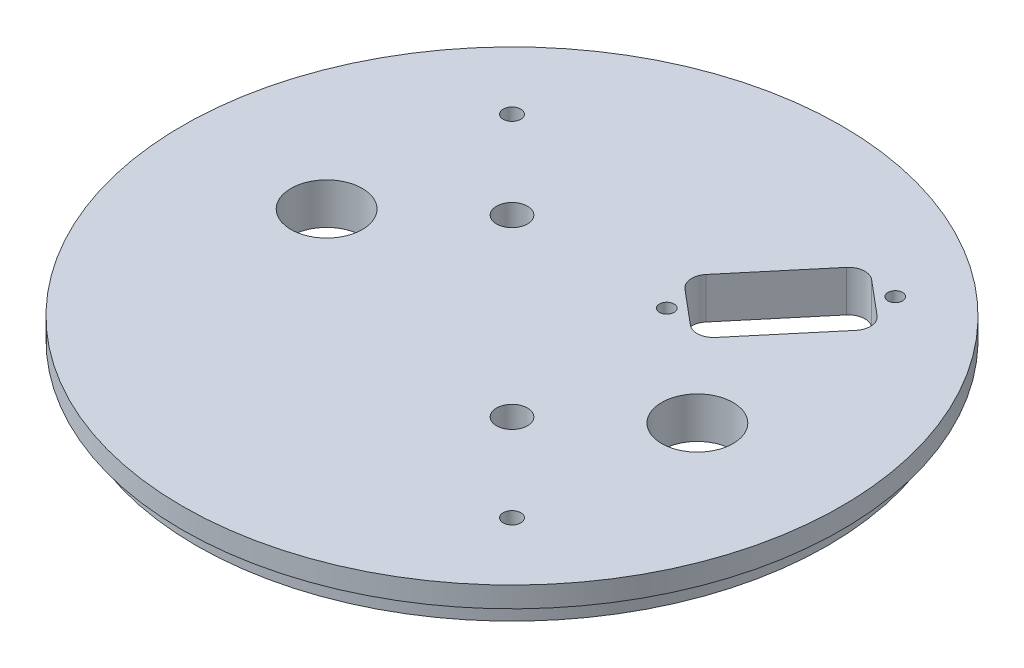
from build123d import *

# Parameters (mm, degrees)
SKETCH1_R                 = 50.8
SKETCH1_R_2               = 5.500000049
SKETCH1_R_3               = 1.3589
SKETCH1_R_4               = 2.38125
BOSS_EXTRUDE1_DEPTH       = 6.35
SKETCH2_R                 = 76.2
SKETCH2_R_2               = 48.641
CUT_EXTRUDE1_DEPTH        = 3.175
CUT_EXTRUDE2_START        = -5.969
CUT_EXTRUDE2_DEPTH        = 3.556
TAP_DRILL_FOR_4_40_TAP1_D = 2.2606
CUT_EXTRUDE3_DEPTH        = 73.122135992


with BuildPart() as part:
    # Sketch1 → Boss-Extrude1 (new body)
    with BuildSketch(Plane(origin=(0, 0, 0), x_dir=(1, 0, 0), z_dir=(0, 1, 0))):
        Circle(SKETCH1_R)
        with Locations((28.575, 0)):
            Circle(SKETCH1_R_2, mode=Mode.SUBTRACT)
        with Locations((-28.575, 0)):
            Circle(SKETCH1_R_2, mode=Mode.SUBTRACT)
        with Locations((-26.940768363, 26.940768363)):
            Circle(SKETCH1_R_3, mode=Mode.SUBTRACT)
        with Locations((26.940768363, -26.940768363)):
            Circle(SKETCH1_R_3, mode=Mode.SUBTRACT)
        with Locations((-13.470384182, 13.470384182)):
            Circle(SKETCH1_R_4, mode=Mode.SUBTRACT)
        with Locations((13.470384182, -13.470384182)):
            Circle(SKETCH1_R_4, mode=Mode.SUBTRACT)
    extrude(amount=BOSS_EXTRUDE1_DEPTH)

    # Sketch2 → Cut-Extrude1 (cut)
    with BuildSketch(Plane.XZ):
        Circle(SKETCH2_R)
        Circle(SKETCH2_R_2, mode=Mode.SUBTRACT)
    extrude(amount=-CUT_EXTRUDE1_DEPTH, mode=Mode.SUBTRACT)

    # Sketch3 → Cut-Extrude2 (cut)
    with BuildSketch(Plane(origin=(0, 6.35, 0), x_dir=(1, 0, 0), z_dir=(0, 1, 0)).offset(CUT_EXTRUDE2_START)):
        with BuildLine():
            Line((3.2385, 34.798), (3.2385, 13.97))
            ThreePointArc((3.2385, 13.97), (0, 10.7315), (-3.2385, 13.97))
            Line((-3.2385, 13.97), (-3.2385, 34.798))
            ThreePointArc((-3.2385, 34.798), (0, 38.0365), (3.2385, 34.798))
        make_face()
        with BuildLine():
            Line((3.2385, -34.798), (3.2385, -13.97))
            ThreePointArc((3.2385, -13.97), (0, -10.7315), (-3.2385, -13.97))
            Line((-3.2385, -13.97), (-3.2385, -34.798))
            ThreePointArc((-3.2385, -34.798), (0, -38.0365), (3.2385, -34.798))
        make_face()
    extrude(amount=-CUT_EXTRUDE2_DEPTH, mode=Mode.SUBTRACT)

    # Tap Drill for #4-40 Tap1 (through all)
    with Locations(Plane(origin=(0, 6.35, 0), x_dir=(1, 0, 0), z_dir=(0, 1, 0))):
        with Locations((10.884536857, 12.971685903), (26.954227124, 32.122797011)):
            Hole(TAP_DRILL_FOR_4_40_TAP1_D / 2)

    # Sketch4 → Cut-Extrude3 (cut, through all)
    with BuildSketch(Plane(origin=(0, 6.35, 0), x_dir=(1, 0, 0), z_dir=(0, 1, 0))):
        with BuildLine():
            Line((9.727182938, 16.926982214), (14.980715729, 12.518744787))
            ThreePointArc((14.980715729, 12.518744787), (16.834771844, 11.934163139), (18.559149143, 12.831817144))
            Line((18.559149143, 12.831817144), (28.424653401, 24.589067286))
            ThreePointArc((28.424653401, 24.589067286), (29.009235048, 26.443123401), (28.111581044, 28.1675007))
            Line((28.111581044, 28.1675007), (22.858048253, 32.575738127))
            ThreePointArc((22.858048253, 32.575738127), (21.003992138, 33.160319775), (19.279614839, 32.26266577))
            Line((19.279614839, 32.26266577), (9.414110581, 20.505415628))
            ThreePointArc((9.414110581, 20.505415628), (8.829528933, 18.651359513), (9.727182938, 16.926982214))
        make_face()
    extrude(amount=-CUT_EXTRUDE3_DEPTH, mode=Mode.SUBTRACT)


solid = part.part
